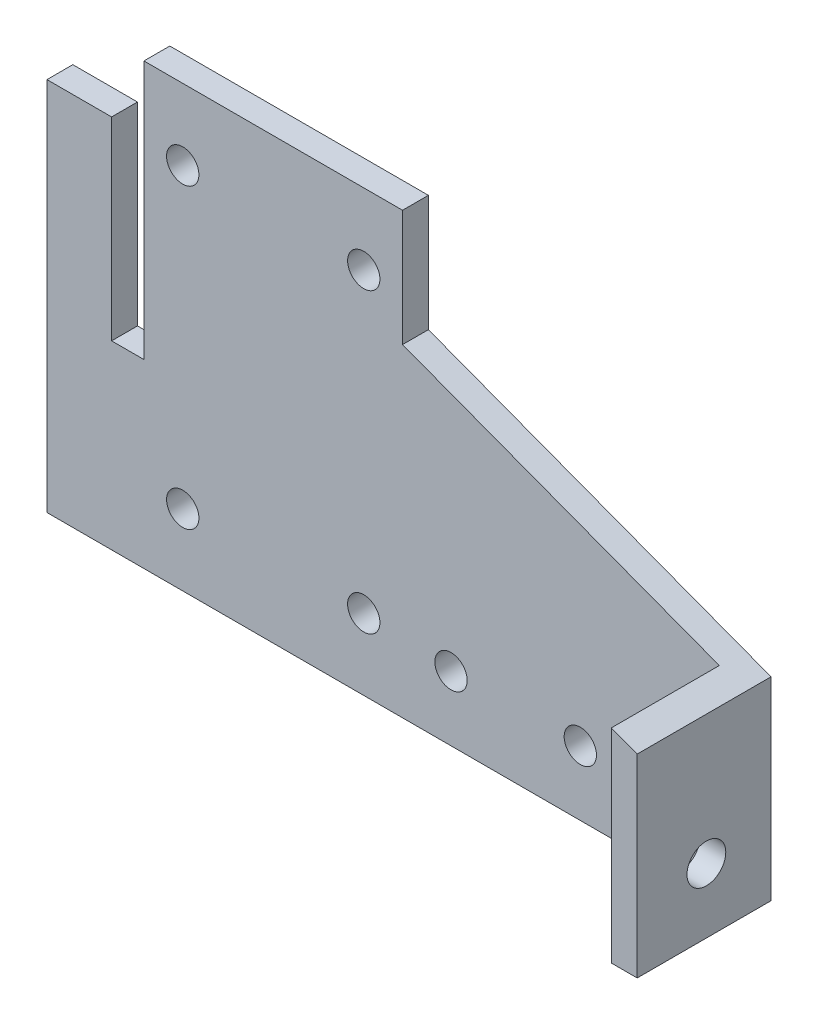
from build123d import *

# Parameters (mm, degrees)
SKETCH_1_R          = 2.5
EXTRUDE_1_DEPTH     = 4
EXTRUDE_2_DEPTH     = 16.7
SKETCH_3_R          = 3
CUT_EXTRUDE_1_DEPTH = 10
CUT_EXTRUDE_2_DEPTH = 10


with BuildPart() as part:
    # Эскиз1 → Бобышка-Вытянуть1 (new body)
    with BuildSketch(Plane.XY):
        Polygon((0, 0), (108, 0), (108, 30), (55, 50), (55, 68), (0, 68), align=None)
        with Locations((21, 57)):
            Circle(SKETCH_1_R, mode=Mode.SUBTRACT)
        with Locations((49, 57)):
            Circle(SKETCH_1_R, mode=Mode.SUBTRACT)
        with Locations((21, 11)):
            Circle(SKETCH_1_R, mode=Mode.SUBTRACT)
        with Locations((49, 11)):
            Circle(SKETCH_1_R, mode=Mode.SUBTRACT)
        with Locations((82.5, 10)):
            Circle(SKETCH_1_R, mode=Mode.SUBTRACT)
        with Locations((62.5, 10)):
            Circle(SKETCH_1_R, mode=Mode.SUBTRACT)
    extrude(amount=EXTRUDE_1_DEPTH)

    # Эскиз2 → Бобышка-Вытянуть2 (add)
    with BuildSketch(Plane.XY.offset(4)):
        Polygon((108, 0), (104, 0), (104, 31.509433962), (108, 30), align=None)
    extrude(amount=EXTRUDE_2_DEPTH)

    # Эскиз3 → Вырез-Вытянуть1 (cut)
    with BuildSketch(Plane(origin=(108, 0, 0), x_dir=(0, 0, -1), z_dir=(1, 0, 0))):
        with Locations((-10, 10)):
            Circle(SKETCH_3_R)
    extrude(amount=-CUT_EXTRUDE_1_DEPTH, mode=Mode.SUBTRACT)

    # Эскиз4 → Вырез-Вытянуть2 (cut)
    with BuildSketch(Plane.XY.offset(4)):
        Polygon((0, 68), (15, 68), (15, 58), (15, 28), (10, 28), (10, 58), (0, 58), align=None)
    extrude(amount=-CUT_EXTRUDE_2_DEPTH, mode=Mode.SUBTRACT)


solid = part.part
